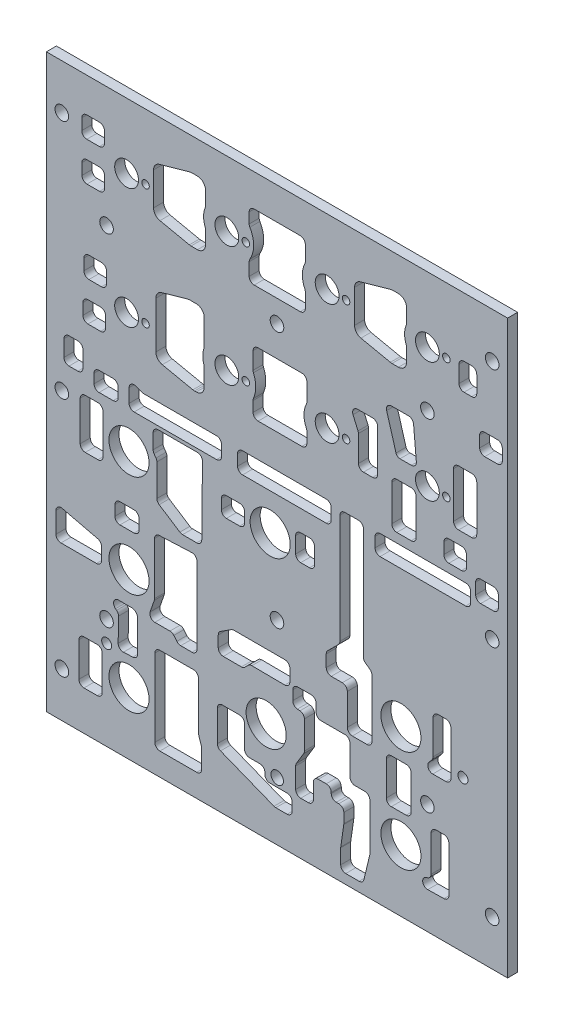
from build123d import *

# Parameters (mm, degrees)
SKETCH1_W                        = 146.05
SKETCH1_H                        = 180.975
BOSS_EXTRUDE1_DEPTH              = 3.175
F_6_CLEARANCE_HOLE1_D            = 4.3053
F_19_64_0_29688_DIAMETER_HOLE1_D = 7.540752
F_1_2_0_5_DIAMETER_HOLE1_D       = 12.7
F_5_32_0_15625_DIAMETER_HOLE1_D  = 3.96875
F_3_32_0_09375_DIAMETER_HOLE1_D  = 2.38125
SKETCH14_R                       = 1.5875
CUT_EXTRUDE1_DEPTH               = 233.578231462


with BuildPart() as part:
    # Sketch1 → Boss-Extrude1 (new body)
    with BuildSketch(Plane.XY):
        with Locations((-73.025, 90.4875)):
            Rectangle(SKETCH1_W, SKETCH1_H)
    extrude(amount=-BOSS_EXTRUDE1_DEPTH)

    # #6 Clearance Hole1 (through all)
    with Locations(Plane(origin=(0, 0, -3.175), x_dir=(-1, 0, 0), z_dir=(0, 0, -1))):
        with Locations((25.4, 142.875), (73.025, 142.875), (127, 142.875), (25.4, 34.925), (73.025, 61.647038728), (127, 34.925), (4.8895, 14.2875), (141.1605, 14.2875), (4.8895, 90.4875), (141.1605, 90.4875), (141.1605, 166.6875), (4.8895, 166.6875)):
            Hole(F_6_CLEARANCE_HOLE1_D / 2)

    # 19/64 (0.29688) Diameter Hole1 (through all)
    with Locations(Plane(origin=(0, 0, -3.175), x_dir=(-1, 0, 0), z_dir=(0, 0, -1))):
        with Locations((25.4, 160.3248), (57.15, 160.3248), (88.9, 160.3248), (120.65, 160.3248), (25.4, 122.2248), (57.15, 122.2248), (88.9, 122.2248), (120.65, 122.2248)):
            Hole(F_19_64_0_29688_DIAMETER_HOLE1_D / 2)

    # 1/2 (0.5) Diameter Hole1 (through all)
    with Locations(Plane(origin=(0, 0, -3.175), x_dir=(-1, 0, 0), z_dir=(0, 0, -1))):
        with Locations((75.184, 84.455), (119.888, 84.455), (119.888, 52.07), (33.782, 52.07), (33.782, 19.685), (119.888, 19.685), (76.454, 31.496)):
            Hole(F_1_2_0_5_DIAMETER_HOLE1_D / 2)

    # 5/32 (0.15625) Diameter Hole1 (through all)
    with Locations(Plane(origin=(0, 0, -3.175), x_dir=(-1, 0, 0), z_dir=(0, 0, -1))):
        with Locations((72.963204011, 18.468172011)):
            Hole(F_5_32_0_15625_DIAMETER_HOLE1_D / 2)

    # 3/32 (0.09375) Diameter Hole1 (through all)
    with Locations(Plane(origin=(0, 0, -3.175), x_dir=(-1, 0, 0), z_dir=(0, 0, -1))):
        with Locations((19.4, 160.324800026), (51.15, 160.324800026), (82.9, 160.324800026), (114.65, 160.324800026), (114.65, 122.224800026), (82.9, 122.224800026), (51.15, 122.224800026), (19.4, 122.224800026)):
            Hole(F_3_32_0_09375_DIAMETER_HOLE1_D / 2)

    # Sketch14 → Cut-Extrude1 (cut, through all)
    with BuildSketch(Plane(origin=(0, 0, -3.175), x_dir=(-1, 0, 0), z_dir=(0, 0, -1))):
        with Locations((14.132946824, 47.879219258)):
            Circle(SKETCH14_R)
        with Locations((126.963022534, 28.317577565)):
            Circle(SKETCH14_R)
        with BuildLine():
            Line((9.767217663, 160.63285084), (9.767217663, 155.327245177))
            ThreePointArc((9.767217663, 155.327245177), (10.232185648, 154.204713162), (11.354717663, 153.739745177))
            Line((11.354717663, 153.739745177), (13.801478439, 153.739745177))
            ThreePointArc((13.801478439, 153.739745177), (14.924010454, 154.204713162), (15.388978439, 155.327245177))
            Line((15.388978439, 155.327245177), (15.388978439, 160.63285084))
            ThreePointArc((15.388978439, 160.63285084), (14.924010454, 161.755382855), (13.801478439, 162.22035084))
            Line((13.801478439, 162.22035084), (11.354717663, 162.22035084))
            ThreePointArc((11.354717663, 162.22035084), (10.232185648, 161.755382855), (9.767217663, 160.63285084))
        make_face()
        with BuildLine():
            Line((34.558637989, 170.414185492), (36.400339795, 170.414185492))
            ThreePointArc((36.400339795, 170.414185492), (36.751612031, 170.389778427), (37.09613346, 170.317026292))
            Line((37.09613346, 170.317026292), (46.619141898, 167.604590452))
            ThreePointArc((46.619141898, 167.604590452), (47.950528037, 166.692155495), (48.463348234, 165.161749652))
            Line((48.463348234, 165.161749652), (48.463348234, 154.740614372))
            ThreePointArc((48.463348234, 154.740614372), (47.896464908, 153.14111114), (46.448851707, 152.255569886))
            Line((46.448851707, 152.255569886), (37.123509045, 150.283573011))
            ThreePointArc((37.123509045, 150.283573011), (36.862190171, 150.242393735), (36.598005572, 150.228617497))
            Line((36.598005572, 150.228617497), (34.558637989, 150.228617497))
            ThreePointArc((34.558637989, 150.228617497), (32.762586765, 150.972566273), (32.018637989, 152.768617497))
            Line((32.018637989, 152.768617497), (32.018637989, 156.939609479))
            ThreePointArc((32.018637989, 156.939609479), (32.057812591, 157.383988064), (32.17412801, 157.814659282))
            ThreePointArc((32.17412801, 157.814659282), (32.61698961, 160.306947565), (32.17412801, 162.799235847))
            ThreePointArc((32.17412801, 162.799235847), (32.057812591, 163.229907066), (32.018637989, 163.67428565))
            Line((32.018637989, 163.67428565), (32.018637989, 167.874185492))
            ThreePointArc((32.018637989, 167.874185492), (32.762586765, 169.670236716), (34.558637989, 170.414185492))
        make_face()
        with BuildLine():
            Line((98.211458819, 170.8080376), (100.053160625, 170.8080376))
            ThreePointArc((100.053160625, 170.8080376), (100.40443286, 170.783630536), (100.748954289, 170.710878401))
            Line((100.748954289, 170.710878401), (110.271962728, 167.998442561))
            ThreePointArc((110.271962728, 167.998442561), (111.603348866, 167.086007604), (112.116169063, 165.55560176))
            Line((112.116169063, 165.55560176), (112.116169063, 155.13446648))
            ThreePointArc((112.116169063, 155.13446648), (111.549285738, 153.534963248), (110.101672537, 152.649421994))
            Line((110.101672537, 152.649421994), (100.776329875, 150.677425119))
            ThreePointArc((100.776329875, 150.677425119), (100.515011, 150.636245843), (100.250826401, 150.622469606))
            Line((100.250826401, 150.622469606), (98.211458819, 150.622469606))
            ThreePointArc((98.211458819, 150.622469606), (96.415407595, 151.366418381), (95.671458819, 153.162469606))
            Line((95.671458819, 153.162469606), (95.671458819, 157.333461588))
            ThreePointArc((95.671458819, 157.333461588), (95.71063342, 157.777840172), (95.82694884, 158.208511391))
            ThreePointArc((95.82694884, 158.208511391), (96.26981044, 160.700799673), (95.82694884, 163.193087955))
            ThreePointArc((95.82694884, 163.193087955), (95.71063342, 163.623759174), (95.671458819, 164.068137758))
            Line((95.671458819, 164.068137758), (95.671458819, 168.2680376))
            ThreePointArc((95.671458819, 168.2680376), (96.415407595, 170.064088824), (98.211458819, 170.8080376))
        make_face()
        with BuildLine():
            Line((81.82809692, 169.167810595), (81.82809692, 165.880408811))
            ThreePointArc((81.82809692, 165.880408811), (81.772213791, 165.462909096), (81.608498795, 165.074803008))
            ThreePointArc((81.608498795, 165.074803008), (80.416199874, 160.700799673), (81.608498795, 156.326796338))
            ThreePointArc((81.608498795, 156.326796338), (81.772213791, 155.938690249), (81.82809692, 155.521190535))
            Line((81.82809692, 155.521190535), (81.82809692, 151.496551485))
            ThreePointArc((81.82809692, 151.496551485), (81.363128935, 150.37401947), (80.24059692, 149.909051485))
            Line((80.24059692, 149.909051485), (65.652230002, 149.909051485))
            ThreePointArc((65.652230002, 149.909051485), (64.529697987, 150.37401947), (64.064730002, 151.496551485))
            Line((64.064730002, 151.496551485), (64.064730002, 156.208791944))
            ThreePointArc((64.064730002, 156.208791944), (64.104453531, 156.561700215), (64.221636141, 156.896947054))
            ThreePointArc((64.221636141, 156.896947054), (64.999149824, 160.306947565), (64.221636141, 163.716948075))
            ThreePointArc((64.221636141, 163.716948075), (64.104453531, 164.052194914), (64.064730002, 164.405103185))
            Line((64.064730002, 164.405103185), (64.064730002, 169.167810595))
            ThreePointArc((64.064730002, 169.167810595), (64.529697987, 170.29034261), (65.652230002, 170.755310595))
            Line((65.652230002, 170.755310595), (80.24059692, 170.755310595))
            ThreePointArc((80.24059692, 170.755310595), (81.363128935, 170.29034261), (81.82809692, 169.167810595))
        make_face()
        with BuildLine():
            Line((129.251171634, 170.067348882), (133.253874874, 170.067348882))
            ThreePointArc((133.253874874, 170.067348882), (134.376406889, 169.602380897), (134.841374874, 168.479848882))
            Line((134.841374874, 168.479848882), (134.841374874, 164.977188829))
            ThreePointArc((134.841374874, 164.977188829), (134.376406889, 163.854656814), (133.253874874, 163.389688829))
            Line((133.253874874, 163.389688829), (129.251171634, 163.389688829))
            ThreePointArc((129.251171634, 163.389688829), (128.128639619, 163.854656814), (127.663671634, 164.977188829))
            Line((127.663671634, 164.977188829), (127.663671634, 168.479848882))
            ThreePointArc((127.663671634, 168.479848882), (128.128639619, 169.602380897), (129.251171634, 170.067348882))
        make_face()
        with BuildLine():
            Line((129.204795221, 157.797391229), (133.207498461, 157.797391229))
            ThreePointArc((133.207498461, 157.797391229), (134.330030476, 157.332423244), (134.794998461, 156.209891229))
            Line((134.794998461, 156.209891229), (134.794998461, 152.707231176))
            ThreePointArc((134.794998461, 152.707231176), (134.330030476, 151.58469916), (133.207498461, 151.119731176))
            Line((133.207498461, 151.119731176), (129.204795221, 151.119731176))
            ThreePointArc((129.204795221, 151.119731176), (128.082263206, 151.58469916), (127.617295221, 152.707231176))
            Line((127.617295221, 152.707231176), (127.617295221, 156.209891229))
            ThreePointArc((127.617295221, 156.209891229), (128.082263206, 157.332423244), (129.204795221, 157.797391229))
        make_face()
        with BuildLine():
            Line((9.767217663, 131.102811501), (9.767217663, 116.698032313))
            ThreePointArc((9.767217663, 116.698032313), (10.232185648, 115.575500298), (11.354717663, 115.110532313))
            Line((11.354717663, 115.110532313), (15.532798381, 115.110532313))
            ThreePointArc((15.532798381, 115.110532313), (16.655330396, 115.575500298), (17.120298381, 116.698032313))
            Line((17.120298381, 116.698032313), (17.120298381, 131.102811501))
            ThreePointArc((17.120298381, 131.102811501), (16.655330396, 132.225343516), (15.532798381, 132.690311501))
            Line((15.532798381, 132.690311501), (11.354717663, 132.690311501))
            ThreePointArc((11.354717663, 132.690311501), (10.232185648, 132.225343516), (9.767217663, 131.102811501))
        make_face()
        with BuildLine():
            Line((3.261554384, 146.026764327), (7.264257624, 146.026764327))
            ThreePointArc((7.264257624, 146.026764327), (8.386789639, 145.561796342), (8.851757624, 144.439264327))
            Line((8.851757624, 144.439264327), (8.851757624, 140.936604274))
            ThreePointArc((8.851757624, 140.936604274), (8.386789639, 139.814072259), (7.264257624, 139.349104274))
            Line((7.264257624, 139.349104274), (3.261554384, 139.349104274))
            ThreePointArc((3.261554384, 139.349104274), (2.139022369, 139.814072259), (1.674054384, 140.936604274))
            Line((1.674054384, 140.936604274), (1.674054384, 144.439264327))
            ThreePointArc((1.674054384, 144.439264327), (2.139022369, 145.561796342), (3.261554384, 146.026764327))
        make_face()
        with BuildLine():
            Line((31.359794028, 138.489073114), (36.77295297, 138.489073114))
            ThreePointArc((36.77295297, 138.489073114), (38.043028477, 137.85397243), (38.296882474, 136.456831485))
            Line((38.296882474, 136.456831485), (35.332112308, 126.297897775))
            ThreePointArc((35.332112308, 126.297897775), (34.86364945, 125.621401108), (34.083001786, 125.361219601))
            Line((34.083001786, 125.361219601), (30.477613082, 125.361219601))
            ThreePointArc((30.477613082, 125.361219601), (29.306574985, 125.87688658), (28.896312545, 127.088879727))
            Line((28.896312545, 127.088879727), (29.77849349, 137.04173324))
            ThreePointArc((29.77849349, 137.04173324), (30.287961007, 138.072611211), (31.359794028, 138.489073114))
        make_face()
        with BuildLine():
            Line((48.956021583, 130.010128428), (47.363025781, 126.342086289))
            ThreePointArc((47.363025781, 126.342086289), (47.264830788, 126.032651426), (47.231636398, 125.709711302))
            Line((47.231636398, 125.709711302), (47.231636398, 117.491438614))
            ThreePointArc((47.231636398, 117.491438614), (46.766668413, 116.368906599), (45.644136398, 115.903938614))
            Line((45.644136398, 115.903938614), (42.729312579, 115.903938614))
            ThreePointArc((42.729312579, 115.903938614), (41.606780564, 116.368906599), (41.141812579, 117.491438614))
            Line((41.141812579, 117.491438614), (41.141812579, 130.642503415))
            ThreePointArc((41.141812579, 130.642503415), (41.606780564, 131.76503543), (42.729312579, 132.230003415))
            Line((42.729312579, 132.230003415), (47.499910967, 132.230003415))
            ThreePointArc((47.499910967, 132.230003415), (48.827324155, 131.5132103), (48.956021583, 130.010128428))
        make_face()
        with BuildLine():
            Line((80.603672304, 131.719817461), (80.603672304, 126.35381328))
            ThreePointArc((80.603672304, 126.35381328), (80.572361135, 126.040073625), (80.479662765, 125.738710102))
            ThreePointArc((80.479662765, 125.738710102), (79.767632234, 122.206947565), (80.479662765, 118.675185027))
            ThreePointArc((80.479662765, 118.675185027), (80.572361135, 118.373821505), (80.603672304, 118.060081849))
            Line((80.603672304, 118.060081849), (80.603672304, 114.804299681))
            ThreePointArc((80.603672304, 114.804299681), (80.138704319, 113.681767665), (79.016172304, 113.216799681))
            Line((79.016172304, 113.216799681), (65.155894554, 113.216799681))
            ThreePointArc((65.155894554, 113.216799681), (64.033362539, 113.681767665), (63.568394554, 114.804299681))
            Line((63.568394554, 114.804299681), (63.568394554, 118.242922096))
            ThreePointArc((63.568394554, 118.242922096), (63.609998563, 118.603978648), (63.732629936, 118.946110602))
            ThreePointArc((63.732629936, 118.946110602), (64.494224867, 122.206947565), (63.732629936, 125.467784527))
            ThreePointArc((63.732629936, 125.467784527), (63.609998563, 125.809916481), (63.568394554, 126.170973033))
            Line((63.568394554, 126.170973033), (63.568394554, 131.719817461))
            ThreePointArc((63.568394554, 131.719817461), (64.033362539, 132.842349477), (65.155894554, 133.307317461))
            Line((65.155894554, 133.307317461), (79.016172304, 133.307317461))
            ThreePointArc((79.016172304, 133.307317461), (80.138704319, 132.842349477), (80.603672304, 131.719817461))
        make_face()
        with BuildLine():
            Line((98.598195781, 135.620186627), (100.64553407, 135.620186627))
            ThreePointArc((100.64553407, 135.620186627), (100.996806305, 135.595779562), (101.341327735, 135.523027428))
            Line((101.341327735, 135.523027428), (109.530233549, 133.190583666))
            ThreePointArc((109.530233549, 133.190583666), (110.861619688, 132.278148709), (111.374439884, 130.747742866))
            Line((111.374439884, 130.747742866), (111.374439884, 116.007403466))
            ThreePointArc((111.374439884, 116.007403466), (110.807556559, 114.407900235), (109.359943358, 113.52235898))
            Line((109.359943358, 113.52235898), (99.664902592, 111.472183369))
            ThreePointArc((99.664902592, 111.472183369), (99.403583717, 111.431004093), (99.139399118, 111.417227855))
            Line((99.139399118, 111.417227855), (98.598195781, 111.417227855))
            ThreePointArc((98.598195781, 111.417227855), (96.802144557, 112.161176631), (96.058195781, 113.957227855))
            Line((96.058195781, 113.957227855), (96.058195781, 119.392794856))
            ThreePointArc((96.058195781, 119.392794856), (96.081326261, 119.6829365), (96.150133393, 119.965748754))
            ThreePointArc((96.150133393, 119.965748754), (96.523744405, 122.294087328), (96.150133393, 124.622425902))
            ThreePointArc((96.150133393, 124.622425902), (96.081326261, 124.905238157), (96.058195781, 125.195379801))
            Line((96.058195781, 125.195379801), (96.058195781, 133.080186627))
            ThreePointArc((96.058195781, 133.080186627), (96.802144557, 134.876237851), (98.598195781, 135.620186627))
        make_face()
        with BuildLine():
            Line((128.583632907, 131.935602041), (132.586336146, 131.935602041))
            ThreePointArc((132.586336146, 131.935602041), (133.708868161, 131.470634056), (134.173836146, 130.348102041))
            Line((134.173836146, 130.348102041), (134.173836146, 126.845441988))
            ThreePointArc((134.173836146, 126.845441988), (133.708868161, 125.722909973), (132.586336146, 125.257941988))
            Line((132.586336146, 125.257941988), (128.583632907, 125.257941988))
            ThreePointArc((128.583632907, 125.257941988), (127.461100891, 125.722909973), (126.996132907, 126.845441988))
            Line((126.996132907, 126.845441988), (126.996132907, 130.348102041))
            ThreePointArc((126.996132907, 130.348102041), (127.461100891, 131.470634056), (128.583632907, 131.935602041))
        make_face()
        with BuildLine():
            Line((128.895482339, 119.575386698), (132.898185579, 119.575386698))
            ThreePointArc((132.898185579, 119.575386698), (134.020717594, 119.110418713), (134.485685579, 117.987886698))
            Line((134.485685579, 117.987886698), (134.485685579, 114.485226645))
            ThreePointArc((134.485685579, 114.485226645), (134.020717594, 113.36269463), (132.898185579, 112.897726645))
            Line((132.898185579, 112.897726645), (128.895482339, 112.897726645))
            ThreePointArc((128.895482339, 112.897726645), (127.772950324, 113.36269463), (127.307982339, 114.485226645))
            Line((127.307982339, 114.485226645), (127.307982339, 117.987886698))
            ThreePointArc((127.307982339, 117.987886698), (127.772950324, 119.110418713), (128.895482339, 119.575386698))
        make_face()
        with BuildLine():
            Line((134.485685579, 99.964724525), (134.485685579, 105.096456724))
            ThreePointArc((134.485685579, 105.096456724), (134.950653564, 106.218988739), (136.073185579, 106.683956724))
            Line((136.073185579, 106.683956724), (138.881785017, 106.683956724))
            ThreePointArc((138.881785017, 106.683956724), (140.004317032, 106.218988739), (140.469285017, 105.096456724))
            Line((140.469285017, 105.096456724), (140.469285017, 99.964724525))
            ThreePointArc((140.469285017, 99.964724525), (140.004317032, 98.84219251), (138.881785017, 98.377224525))
            Line((138.881785017, 98.377224525), (136.073185579, 98.377224525))
            ThreePointArc((136.073185579, 98.377224525), (134.950653564, 98.84219251), (134.485685579, 99.964724525))
        make_face()
        with BuildLine():
            Line((4.517320575, 105.101609763), (8.520023814, 105.101609763))
            ThreePointArc((8.520023814, 105.101609763), (9.642555829, 104.636641778), (10.107523814, 103.514109763))
            Line((10.107523814, 103.514109763), (10.107523814, 100.01144971))
            ThreePointArc((10.107523814, 100.01144971), (9.642555829, 98.888917695), (8.520023814, 98.42394971))
            Line((8.520023814, 98.42394971), (4.517320575, 98.42394971))
            ThreePointArc((4.517320575, 98.42394971), (3.39478856, 98.888917695), (2.929820575, 100.01144971))
            Line((2.929820575, 100.01144971), (2.929820575, 103.514109763))
            ThreePointArc((2.929820575, 103.514109763), (3.39478856, 104.636641778), (4.517320575, 105.101609763))
        make_face()
        with BuildLine():
            Line((14.590947251, 111.137221793), (18.593650491, 111.137221793))
            ThreePointArc((18.593650491, 111.137221793), (19.716182506, 110.672253808), (20.181150491, 109.549721793))
            Line((20.181150491, 109.549721793), (20.181150491, 106.04706174))
            ThreePointArc((20.181150491, 106.04706174), (19.716182506, 104.924529725), (18.593650491, 104.45956174))
            Line((18.593650491, 104.45956174), (14.590947251, 104.45956174))
            ThreePointArc((14.590947251, 104.45956174), (13.468415236, 104.924529725), (13.003447251, 106.04706174))
            Line((13.003447251, 106.04706174), (13.003447251, 109.549721793))
            ThreePointArc((13.003447251, 109.549721793), (13.468415236, 110.672253808), (14.590947251, 111.137221793))
        make_face()
        with BuildLine():
            Line((30.535303828, 119.204834387), (35.092795143, 119.204834387))
            ThreePointArc((35.092795143, 119.204834387), (36.215327158, 118.739866403), (36.680295143, 117.617334387))
            Line((36.680295143, 117.617334387), (36.680295143, 106.231957658))
            ThreePointArc((36.680295143, 106.231957658), (36.215327158, 105.109425643), (35.092795143, 104.644457658))
            Line((35.092795143, 104.644457658), (30.535303828, 104.644457658))
            ThreePointArc((30.535303828, 104.644457658), (29.412771813, 105.109425643), (28.947803828, 106.231957658))
            Line((28.947803828, 106.231957658), (28.947803828, 117.617334387))
            ThreePointArc((28.947803828, 117.617334387), (29.412771813, 118.739866403), (30.535303828, 119.204834387))
        make_face()
        with BuildLine():
            Line((45.644136398, 65.153455838), (45.644136398, 100.334854986))
            ThreePointArc((45.644136398, 100.334854986), (46.109104382, 101.457387001), (47.231636398, 101.922354986))
            Line((47.231636398, 101.922354986), (51.530299417, 101.922354986))
            ThreePointArc((51.530299417, 101.922354986), (52.652831432, 101.457387001), (53.117799417, 100.334854986))
            Line((53.117799417, 100.334854986), (53.117799417, 65.783517616))
            ThreePointArc((53.117799417, 65.783517616), (53.238640659, 65.176007667), (53.582767402, 64.6609856))
            Line((53.582767402, 64.6609856), (56.969013712, 61.27473929))
            ThreePointArc((56.969013712, 61.27473929), (57.313140455, 60.759717224), (57.433981697, 60.152207275))
            Line((57.433981697, 60.152207275), (57.433981697, 56.397932406))
            ThreePointArc((57.433981697, 56.397932406), (56.969013712, 55.27540039), (55.846481697, 54.810432406))
            Line((55.846481697, 54.810432406), (52.343430559, 54.810432406))
            ThreePointArc((52.343430559, 54.810432406), (51.220898544, 54.345464421), (50.755930559, 53.222932406))
            Line((50.755930559, 53.222932406), (50.755930559, 43.368905462))
            ThreePointArc((50.755930559, 43.368905462), (50.290962575, 42.246373447), (49.168430559, 41.781405462))
            Line((49.168430559, 41.781405462), (44.55012145, 41.781405462))
            ThreePointArc((44.55012145, 41.781405462), (43.427589434, 42.246373447), (42.96262145, 43.368905462))
            Line((42.96262145, 43.368905462), (42.96262145, 61.595277105))
            ThreePointArc((42.96262145, 61.595277105), (43.136999443, 62.318632096), (43.621824528, 62.88307409))
            Line((43.621824528, 62.88307409), (44.984933319, 63.865658852))
            ThreePointArc((44.984933319, 63.865658852), (45.469758404, 64.430100846), (45.644136398, 65.153455838))
        make_face()
        with BuildLine():
            Line((67.111744061, 82.728660412), (67.111744061, 87.763891138))
            ThreePointArc((67.111744061, 87.763891138), (66.646776076, 88.886423153), (65.524244061, 89.351391138))
            Line((65.524244061, 89.351391138), (62.708939108, 89.351391138))
            ThreePointArc((62.708939108, 89.351391138), (61.586407093, 88.886423153), (61.121439108, 87.763891138))
            Line((61.121439108, 87.763891138), (61.121439108, 82.728660412))
            ThreePointArc((61.121439108, 82.728660412), (61.586407093, 81.606128397), (62.708939108, 81.141160412))
            Line((62.708939108, 81.141160412), (65.524244061, 81.141160412))
            ThreePointArc((65.524244061, 81.141160412), (66.646776076, 81.606128397), (67.111744061, 82.728660412))
        make_face()
        with BuildLine():
            Line((17.962804382, 45.688766309), (17.962804382, 59.68723929))
            ThreePointArc((17.962804382, 59.68723929), (18.427772367, 60.809771305), (19.550304382, 61.27473929))
            Line((19.550304382, 61.27473929), (21.993380848, 61.27473929))
            ThreePointArc((21.993380848, 61.27473929), (23.115912863, 60.809771305), (23.580880848, 59.68723929))
            Line((23.580880848, 59.68723929), (23.580880848, 48.891130409))
            ThreePointArc((23.580880848, 48.891130409), (23.674732752, 48.353383614), (23.945191545, 47.879219258))
            Line((23.945191545, 47.879219258), (24.920167032, 46.70067746))
            ThreePointArc((24.920167032, 46.70067746), (25.133390831, 45.012842017), (23.696977728, 44.101266309))
            Line((23.696977728, 44.101266309), (19.550304382, 44.101266309))
            ThreePointArc((19.550304382, 44.101266309), (18.427772367, 44.566234294), (17.962804382, 45.688766309))
        make_face()
        with BuildLine():
            Line((25.488561941, 14.767801201), (25.65889639, 14.748652835))
            ThreePointArc((25.65889639, 14.748652835), (24.652667298, 15.268240779), (24.248740174, 16.326215966))
            Line((24.248740174, 16.326215966), (24.248740174, 27.680199317))
            ThreePointArc((24.248740174, 27.680199317), (23.783772189, 28.802731332), (22.661240174, 29.267699317))
            Line((22.661240174, 29.267699317), (20.181150491, 29.267699317))
            ThreePointArc((20.181150491, 29.267699317), (19.058618476, 28.802731332), (18.593650491, 27.680199317))
            Line((18.593650491, 27.680199317), (18.593650491, 13.275487543))
            ThreePointArc((18.593650491, 13.275487543), (19.049331281, 12.162320203), (20.154773674, 11.688206688))
            Line((20.154773674, 11.688206688), (25.28484134, 11.602957215))
            ThreePointArc((25.28484134, 11.602957215), (26.895439455, 13.088261949), (25.488561941, 14.767801201))
        make_face()
        with BuildLine():
            Line((32.122803828, 42.542696767), (36.816509998, 42.542696767))
            ThreePointArc((36.816509998, 42.542696767), (37.939042014, 42.077728782), (38.404009998, 40.955196767))
            Line((38.404009998, 40.955196767), (38.404009998, 30.172891696))
            ThreePointArc((38.404009998, 30.172891696), (37.939042014, 29.050359681), (36.816509998, 28.585391696))
            Line((36.816509998, 28.585391696), (32.122803828, 28.585391696))
            ThreePointArc((32.122803828, 28.585391696), (31.000271813, 29.050359681), (30.535303828, 30.172891696))
            Line((30.535303828, 30.172891696), (30.535303828, 40.955196767))
            ThreePointArc((30.535303828, 40.955196767), (31.000271813, 42.077728782), (32.122803828, 42.542696767))
        make_face()
        with BuildLine():
            Line((43.621824528, 25.252329968), (43.621824528, 12.239202135))
            ThreePointArc((43.621824528, 12.239202135), (43.632678938, 12.053878272), (43.665093737, 11.871088684))
            Line((43.665093737, 11.871088684), (43.69525068, 11.744580727))
            Line((43.69525068, 11.744580727), (45.483963354, 4.240955996))
            ThreePointArc((45.483963354, 4.240955996), (46.044381118, 3.363168898), (47.028194145, 3.021569446))
            Line((47.028194145, 3.021569446), (51.26309524, 3.021569446))
            ThreePointArc((51.26309524, 3.021569446), (52.385627255, 3.486537431), (52.85059524, 4.609069446))
            Line((52.85059524, 4.609069446), (52.85059524, 9.285301796))
            ThreePointArc((52.85059524, 9.285301796), (52.846511055, 9.399102525), (52.834279516, 9.512317701))
            Line((52.834279516, 9.512317701), (51.87474445, 16.153290332))
            ThreePointArc((51.87474445, 16.153290332), (51.862512911, 16.266505507), (51.858428726, 16.380306236))
            Line((51.858428726, 16.380306236), (51.858428726, 19.480780516))
            ThreePointArc((51.858428726, 19.480780516), (52.323396711, 20.603312531), (53.445928726, 21.068280516))
            Line((53.445928726, 21.068280516), (54.258981697, 21.068280516))
            ThreePointArc((54.258981697, 21.068280516), (55.381513712, 21.533248501), (55.846481697, 22.655780516))
            Line((55.846481697, 22.655780516), (55.846481697, 22.952945823))
            ThreePointArc((55.846481697, 22.952945823), (56.311449682, 24.075477838), (57.433981697, 24.540445823))
            Line((57.433981697, 24.540445823), (59.92389745, 24.540445823))
            ThreePointArc((59.92389745, 24.540445823), (61.046429465, 24.075477838), (61.51139745, 22.952945823))
            Line((61.51139745, 22.952945823), (61.51139745, 18.130277566))
            ThreePointArc((61.51139745, 18.130277566), (61.976365435, 17.00774555), (63.09889745, 16.542777566))
            Line((63.09889745, 16.542777566), (65.524244061, 16.542777566))
            ThreePointArc((65.524244061, 16.542777566), (66.646776076, 17.00774555), (67.111744061, 18.130277566))
            Line((67.111744061, 18.130277566), (67.111744061, 24.586833106))
            ThreePointArc((67.111744061, 24.586833106), (67.053548088, 25.012726807), (66.883226966, 25.407394935))
            Line((66.883226966, 25.407394935), (64.552352596, 29.267699317))
            ThreePointArc((64.552352596, 29.267699317), (64.382031474, 29.662367445), (64.323835501, 30.088261146))
            Line((64.323835501, 30.088261146), (64.323835501, 38.924226777))
            ThreePointArc((64.323835501, 38.924226777), (64.777980628, 39.91970434), (65.768349816, 40.38488414))
            Line((65.768349816, 40.38488414), (66.583495086, 40.456212154))
            ThreePointArc((66.583495086, 40.456212154), (67.615547791, 40.965178334), (68.032612157, 42.037669208))
            Line((68.032612157, 42.037669208), (68.032612157, 44.997953003))
            ThreePointArc((68.032612157, 44.997953003), (67.567644172, 46.120485018), (66.445112157, 46.585453003))
            Line((66.445112157, 46.585453003), (62.237892426, 46.585453003))
            ThreePointArc((62.237892426, 46.585453003), (61.115360411, 46.120485018), (60.650392426, 44.997953003))
            Line((60.650392426, 44.997953003), (60.650392426, 42.599158672))
            ThreePointArc((60.650392426, 42.599158672), (60.185424441, 41.476626656), (59.062892426, 41.011658672))
            Line((59.062892426, 41.011658672), (51.495094787, 41.011658672))
            ThreePointArc((51.495094787, 41.011658672), (50.372562772, 40.546690687), (49.907594787, 39.424158672))
            Line((49.907594787, 39.424158672), (49.907594787, 30.172891696))
            ThreePointArc((49.907594787, 30.172891696), (49.442626802, 29.050359681), (48.320094787, 28.585391696))
            Line((48.320094787, 28.585391696), (45.209324528, 28.585391696))
            ThreePointArc((45.209324528, 28.585391696), (44.086792513, 28.120423711), (43.621824528, 26.997891696))
            Line((43.621824528, 26.997891696), (43.621824528, 25.252329968))
        make_face()
        with BuildLine():
            Line((68.955267824, 46.654614196), (68.955267824, 50.449415892))
            ThreePointArc((68.955267824, 50.449415892), (69.420235809, 51.571947907), (70.542767824, 52.036915892))
            Line((70.542767824, 52.036915892), (86.63255067, 52.036915892))
            ThreePointArc((86.63255067, 52.036915892), (87.077806475, 51.973195245), (87.487318043, 51.78714867))
            Line((87.487318043, 51.78714867), (90.894411426, 49.610127739))
            ThreePointArc((90.894411426, 49.610127739), (91.431962166, 49.035026275), (91.627144053, 48.27239496))
            Line((91.627144053, 48.27239496), (91.627144053, 44.760968252))
            ThreePointArc((91.627144053, 44.760968252), (91.162176068, 43.638436237), (90.039644053, 43.173468252))
            Line((90.039644053, 43.173468252), (84.301424443, 43.173468252))
            ThreePointArc((84.301424443, 43.173468252), (83.693914494, 43.294309494), (83.178892427, 43.638436237))
            Line((83.178892427, 43.638436237), (82.12970624, 44.687622425))
            ThreePointArc((82.12970624, 44.687622425), (81.608681763, 45.034221081), (80.994191404, 45.152537321))
            Line((80.994191404, 45.152537321), (70.555750644, 45.067167285))
            ThreePointArc((70.555750644, 45.067167285), (69.424835352, 45.527501408), (68.955267824, 46.654614196))
        make_face()
        with BuildLine():
            Line((91.912830974, 18.298973395), (91.912830974, 28.11335216))
            ThreePointArc((91.912830974, 28.11335216), (91.447862989, 29.235884175), (90.325330974, 29.70085216))
            Line((90.325330974, 29.70085216), (84.88947102, 29.70085216))
            ThreePointArc((84.88947102, 29.70085216), (83.766939005, 29.235884175), (83.30197102, 28.11335216))
            Line((83.30197102, 28.11335216), (83.30197102, 21.12355132))
            ThreePointArc((83.30197102, 21.12355132), (82.837003035, 20.001019305), (81.71447102, 19.53605132))
            Line((81.71447102, 19.53605132), (78.443784352, 19.53605132))
            ThreePointArc((78.443784352, 19.53605132), (77.321252337, 19.071083335), (76.856284352, 17.94855132))
            Line((76.856284352, 17.94855132), (76.856284352, 17.380743472))
            ThreePointArc((76.856284352, 17.380743472), (76.391316367, 16.258211457), (75.268784352, 15.793243472))
            Line((75.268784352, 15.793243472), (69.818441453, 15.793243472))
            ThreePointArc((69.818441453, 15.793243472), (68.695909438, 15.328275487), (68.230941453, 14.205743472))
            Line((68.230941453, 14.205743472), (68.230941453, 11.593979237))
            ThreePointArc((68.230941453, 11.593979237), (68.695909438, 10.471447222), (69.818441453, 10.006479237))
            Line((69.818441453, 10.006479237), (73.388100038, 10.006479237))
            ThreePointArc((73.388100038, 10.006479237), (73.685530866, 10.034591167), (73.972427703, 10.117931328))
            Line((73.972427703, 10.117931328), (90.909658639, 16.822925486))
            ThreePointArc((90.909658639, 16.822925486), (91.638300208, 17.406634871), (91.912830974, 18.298973395))
        make_face()
        with BuildLine():
            Line((84.848928202, 87.763891138), (89.065440256, 87.763891138))
            ThreePointArc((89.065440256, 87.763891138), (90.187972271, 87.298923153), (90.652940256, 86.176391138))
            Line((90.652940256, 86.176391138), (90.652940256, 83.104642863))
            ThreePointArc((90.652940256, 83.104642863), (90.187972271, 81.982110847), (89.065440256, 81.517142863))
            Line((89.065440256, 81.517142863), (84.848928202, 81.517142863))
            ThreePointArc((84.848928202, 81.517142863), (83.726396187, 81.982110847), (83.261428202, 83.104642863))
            Line((83.261428202, 83.104642863), (83.261428202, 86.176391138))
            ThreePointArc((83.261428202, 86.176391138), (83.726396187, 87.298923153), (84.848928202, 87.763891138))
        make_face()
        with BuildLine():
            Line((129.719832819, 92.920324011), (133.746574015, 92.920324011))
            ThreePointArc((133.746574015, 92.920324011), (134.86910603, 92.455356026), (135.334074015, 91.332824011))
            Line((135.334074015, 91.332824011), (135.334074015, 78.857031803))
            ThreePointArc((135.334074015, 78.857031803), (134.86910603, 77.734499788), (133.746574015, 77.269531803))
            Line((133.746574015, 77.269531803), (129.719832819, 77.269531803))
            ThreePointArc((129.719832819, 77.269531803), (128.597300803, 77.734499788), (128.132332819, 78.857031803))
            Line((128.132332819, 78.857031803), (128.132332819, 91.332824011))
            ThreePointArc((128.132332819, 91.332824011), (128.597300803, 92.455356026), (129.719832819, 92.920324011))
        make_face()
        with BuildLine():
            Line((143.019985315, 56.717315352), (143.019985315, 50.184019447))
            ThreePointArc((143.019985315, 50.184019447), (142.55501733, 49.061487431), (141.432485315, 48.596519447))
            Line((141.432485315, 48.596519447), (130.171132907, 48.596519447))
            ThreePointArc((130.171132907, 48.596519447), (129.048600891, 49.061487431), (128.583632907, 50.184019447))
            Line((128.583632907, 50.184019447), (128.583632907, 54.036010936))
            ThreePointArc((128.583632907, 54.036010936), (128.925363595, 55.019990138), (129.803431422, 55.580339873))
            Line((129.803431422, 55.580339873), (141.06478383, 58.26164429))
            ThreePointArc((141.06478383, 58.26164429), (142.416464517, 57.963084664), (143.019985315, 56.717315352))
        make_face()
        with BuildLine():
            Line((135.733601408, 24.895379819), (135.733601408, 14.058917599))
            ThreePointArc((135.733601408, 14.058917599), (135.268633423, 12.936385584), (134.146101408, 12.471417599))
            Line((134.146101408, 12.471417599), (129.950688404, 12.471417599))
            ThreePointArc((129.950688404, 12.471417599), (128.828156389, 12.936385584), (128.363188404, 14.058917599))
            Line((128.363188404, 14.058917599), (128.363188404, 24.895379819))
            ThreePointArc((128.363188404, 24.895379819), (128.828156389, 26.017911835), (129.950688404, 26.482879819))
            Line((129.950688404, 26.482879819), (134.146101408, 26.482879819))
            ThreePointArc((134.146101408, 26.482879819), (135.268633423, 26.017911835), (135.733601408, 24.895379819))
        make_face()
        with BuildLine():
            Line((98.437411263, 70.123191958), (102.926957711, 70.123191958))
            ThreePointArc((102.926957711, 70.123191958), (103.378843137, 70.188865485), (103.79334033, 70.380452352))
            Line((103.79334033, 70.380452352), (110.329584995, 74.637496535))
            ThreePointArc((110.329584995, 74.637496535), (110.858827443, 75.211173571), (111.050702376, 75.96773614))
            Line((111.050702376, 75.96773614), (111.050702376, 86.020535796))
            ThreePointArc((111.050702376, 86.020535796), (111.125087816, 86.500786332), (111.341273183, 86.936030699))
            Line((111.341273183, 86.936030699), (111.963646468, 87.817711284))
            ThreePointArc((111.963646468, 87.817711284), (112.179831835, 88.252955651), (112.254217275, 88.733206187))
            Line((112.254217275, 88.733206187), (112.254217275, 93.434843616))
            ThreePointArc((112.254217275, 93.434843616), (111.78924929, 94.557375631), (110.666717275, 95.022343616))
            Line((110.666717275, 95.022343616), (98.214706811, 95.022343616))
            ThreePointArc((98.214706811, 95.022343616), (97.086435967, 94.551607312), (96.627290221, 93.418570265))
            Line((96.627290221, 93.418570265), (96.849994673, 71.694418607))
            ThreePointArc((96.849994673, 71.694418607), (97.320647567, 70.582421114), (98.437411263, 70.123191958))
        make_face()
        with BuildLine():
            Line((13.28672823, 101.718890773), (40.392708584, 101.718890773))
            ThreePointArc((40.392708584, 101.718890773), (41.515240599, 101.253922788), (41.980208584, 100.131390773))
            Line((41.980208584, 100.131390773), (41.980208584, 96.963546594))
            ThreePointArc((41.980208584, 96.963546594), (41.515240599, 95.841014579), (40.392708584, 95.376046594))
            Line((40.392708584, 95.376046594), (13.28672823, 95.376046594))
            ThreePointArc((13.28672823, 95.376046594), (12.164196215, 95.841014579), (11.69922823, 96.963546594))
            Line((11.69922823, 96.963546594), (11.69922823, 100.131390773))
            ThreePointArc((11.69922823, 100.131390773), (12.164196215, 101.253922788), (13.28672823, 101.718890773))
        make_face()
        with BuildLine():
            Line((83.921634773, 102.625071879), (57.433981697, 102.625071879))
            ThreePointArc((57.433981697, 102.625071879), (56.311449682, 102.160103894), (55.846481697, 101.037571879))
            Line((55.846481697, 101.037571879), (55.846481697, 97.601721607))
            ThreePointArc((55.846481697, 97.601721607), (56.311449682, 96.479189591), (57.433981697, 96.014221607))
            Line((57.433981697, 96.014221607), (83.921634773, 96.014221607))
            ThreePointArc((83.921634773, 96.014221607), (85.044166788, 96.479189591), (85.509134773, 97.601721607))
            Line((85.509134773, 97.601721607), (85.509134773, 101.037571879))
            ThreePointArc((85.509134773, 101.037571879), (85.044166788, 102.160103894), (83.921634773, 102.625071879))
        make_face()
        with BuildLine():
            Line((92.168891191, 102.625071879), (115.232026793, 102.625071879))
            ThreePointArc((115.232026793, 102.625071879), (115.51507018, 102.650508279), (115.7890432, 102.726002348))
            Line((115.7890432, 102.726002348), (117.711087225, 103.446190697))
            ThreePointArc((117.711087225, 103.446190697), (119.172507497, 103.264308828), (119.855603632, 101.959621165))
            Line((119.855603632, 101.959621165), (119.855603632, 97.677745024))
            ThreePointArc((119.855603632, 97.677745024), (119.390635647, 96.555213009), (118.268103632, 96.090245024))
            Line((118.268103632, 96.090245024), (92.168891191, 96.090245024))
            ThreePointArc((92.168891191, 96.090245024), (91.046359176, 96.555213009), (90.581391191, 97.677745024))
            Line((90.581391191, 97.677745024), (90.581391191, 101.037571879))
            ThreePointArc((90.581391191, 101.037571879), (91.046359176, 102.160103894), (92.168891191, 102.625071879))
        make_face()
        with BuildLine():
            Line((124.902684895, 101.959621165), (129.379109069, 101.959621165))
            ThreePointArc((129.379109069, 101.959621165), (130.501641084, 101.49465318), (130.966609069, 100.372121165))
            Line((130.966609069, 100.372121165), (130.966609069, 97.473067514))
            ThreePointArc((130.966609069, 97.473067514), (130.501641084, 96.350535499), (129.379109069, 95.885567514))
            Line((129.379109069, 95.885567514), (124.902684895, 95.885567514))
            ThreePointArc((124.902684895, 95.885567514), (123.78015288, 96.350535499), (123.315184895, 97.473067514))
            Line((123.315184895, 97.473067514), (123.315184895, 100.372121165))
            ThreePointArc((123.315184895, 100.372121165), (123.78015288, 101.49465318), (124.902684895, 101.959621165))
        make_face()
        with BuildLine():
            Line((118.286830366, 62.88307409), (122.742841132, 62.88307409))
            ThreePointArc((122.742841132, 62.88307409), (123.865373148, 63.348042075), (124.330341132, 64.47057409))
            Line((124.330341132, 64.47057409), (124.330341132, 67.66746808))
            ThreePointArc((124.330341132, 67.66746808), (123.865373148, 68.790000096), (122.742841132, 69.25496808))
            Line((122.742841132, 69.25496808), (118.286830366, 69.25496808))
            ThreePointArc((118.286830366, 69.25496808), (117.164298351, 68.790000096), (116.699330366, 67.66746808))
            Line((116.699330366, 67.66746808), (116.699330366, 64.47057409))
            ThreePointArc((116.699330366, 64.47057409), (117.164298351, 63.348042075), (118.286830366, 62.88307409))
        make_face()
        with BuildLine():
            Line((99.997531757, 66.667195334), (110.276847343, 66.214900422))
            ThreePointArc((110.276847343, 66.214900422), (111.354002875, 65.726517575), (111.794564086, 64.628934929))
            Line((111.794564086, 64.628934929), (111.794564086, 48.151417652))
            ThreePointArc((111.794564086, 48.151417652), (111.816464274, 47.888637368), (111.881560594, 47.633107398))
            Line((111.881560594, 47.633107398), (113.208616774, 43.791291771))
            ThreePointArc((113.208616774, 43.791291771), (113.000973247, 42.351748995), (111.708113282, 41.685481517))
            Line((111.708113282, 41.685481517), (106.918524274, 41.685481517))
            ThreePointArc((106.918524274, 41.685481517), (106.241474, 41.533864234), (105.693749739, 41.107973394))
            Line((105.693749739, 41.107973394), (104.737607513, 39.948500057))
            ThreePointArc((104.737607513, 39.948500057), (104.189883252, 39.522609216), (103.512832978, 39.370991933))
            Line((103.512832978, 39.370991933), (99.9277485, 39.370991933))
            ThreePointArc((99.9277485, 39.370991933), (98.805216484, 39.835959918), (98.3402485, 40.958491933))
            Line((98.3402485, 40.958491933), (98.3402485, 65.08122984))
            ThreePointArc((98.3402485, 65.08122984), (98.830165854, 66.228168629), (99.997531757, 66.667195334))
        make_face()
        with BuildLine():
            Line((123.315503898, 30.139368788), (123.199880099, 37.651850025))
            ThreePointArc((123.199880099, 37.651850025), (123.353989354, 38.358985173), (123.805975757, 38.924226777))
            Line((123.805975757, 38.924226777), (124.156940964, 39.200178328))
            ThreePointArc((124.156940964, 39.200178328), (124.675936511, 40.967278577), (123.175724612, 42.035624929))
            Line((123.175724612, 42.035624929), (119.097385031, 42.035624929))
            ThreePointArc((119.097385031, 42.035624929), (117.727264266, 41.468102326), (117.159741662, 40.09798156))
            Line((117.159741662, 40.09798156), (117.159741662, 30.242435405))
            ThreePointArc((117.159741662, 30.242435405), (117.600976822, 29.144148937), (118.679405493, 28.656385436))
            Line((118.679405493, 28.656385436), (121.660355719, 28.528888668))
            ThreePointArc((121.660355719, 28.528888668), (122.835266078, 28.977158787), (123.315503898, 30.139368788))
        make_face()
        with BuildLine():
            Line((99.476984905, 34.823662663), (110.120613282, 34.823662663))
            ThreePointArc((110.120613282, 34.823662663), (111.243145297, 34.358694678), (111.708113282, 33.236162663))
            Line((111.708113282, 33.236162663), (111.708113282, 8.77390157))
            ThreePointArc((111.708113282, 8.77390157), (111.243145297, 7.651369554), (110.120613282, 7.18640157))
            Line((110.120613282, 7.18640157), (98.437494673, 7.18640157))
            ThreePointArc((98.437494673, 7.18640157), (97.314962658, 7.651369554), (96.849994673, 8.77390157))
            Line((96.849994673, 8.77390157), (96.849994673, 14.497268093))
            ThreePointArc((96.849994673, 14.497268093), (96.869531718, 14.745559094), (96.927661975, 14.987738759))
            Line((96.927661975, 14.987738759), (97.811817603, 17.709465397))
            ThreePointArc((97.811817603, 17.709465397), (97.86994786, 17.951645062), (97.889484905, 18.199936062))
            Line((97.889484905, 18.199936062), (97.889484905, 33.236162663))
            ThreePointArc((97.889484905, 33.236162663), (98.35445289, 34.358694678), (99.476984905, 34.823662663))
        make_face()
    extrude(amount=-CUT_EXTRUDE1_DEPTH, mode=Mode.SUBTRACT)


solid = part.part
